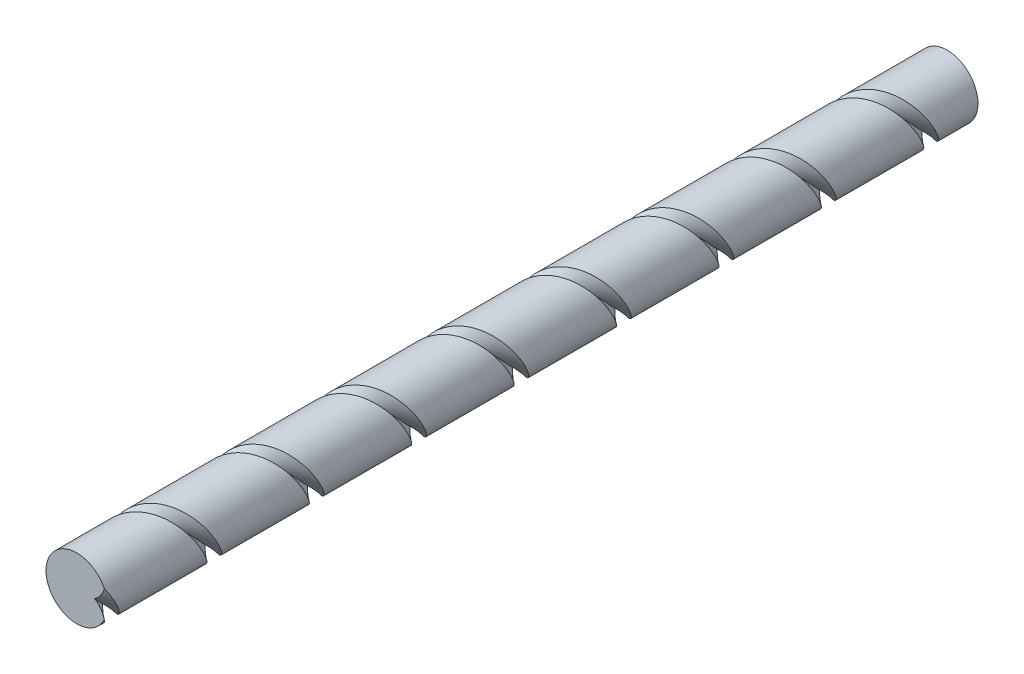
from build123d import *

# Parameters (mm, degrees)
CROQUIS1_R              = 6
SALIENTE_EXTRUIR1_DEPTH = 170
CORTAR_BARRER2_PITCH    = 20


with BuildPart() as part:
    # Croquis1 → Saliente-Extruir1 (new body)
    with BuildSketch(Plane.XY):
        Circle(CROQUIS1_R)
    extrude(amount=SALIENTE_EXTRUIR1_DEPTH)

    # Cortar-Barrer2: arcs per turn and ends read off the stored shape
    # Cortar-Barrer2: the profile of Croquis4 screwed along a right-hand helix through 61 turns, 12 arcs to a turn; built about Z, then put on its axis
    cortar_barrer2_z = Axis((0, 0, 0), (0, 0, 1))
    cortar_barrer2_corners = [(6, 0, -20), (6, 0, -18.556624327), (3.5, 0, -20), (6, 0, -21.443375673)]
    with BuildLine(mode=Mode.PRIVATE) as cortar_barrer2_profile:
        Line(cortar_barrer2_corners[0], cortar_barrer2_corners[1])
        Line(cortar_barrer2_corners[1], cortar_barrer2_corners[2])
        Line(cortar_barrer2_corners[2], cortar_barrer2_corners[3])
        Line(cortar_barrer2_corners[3], cortar_barrer2_corners[0])
    cortar_barrer2_cap = Face(cortar_barrer2_profile.wire())
    cortar_barrer2_turn_angles = [0, 15, 30, 45, 60, 75, 90, 105, 120, 135, 150, 165, 180, 195, 210, 225, 240, 255, 270, 285, 300, 315, 330, 345, 360]
    cortar_barrer2_turn_weights = [1, 0.9659258262890683, 1, 0.9659258262890683, 1, 0.9659258262890683, 1, 0.9659258262890683, 1, 0.9659258262890683, 1, 0.9659258262890683, 1, 0.9659258262890683, 1, 0.9659258262890683, 1, 0.9659258262890683, 1, 0.9659258262890683, 1, 0.9659258262890683, 1, 0.9659258262890683, 1]
    cortar_barrer2_turn_rails = [Edge.make_bspline([Vector(p[0], p[1], 0).rotate(cortar_barrer2_z, cortar_barrer2_turn_angles[k]) / cortar_barrer2_turn_weights[k] + Vector(0, 0, p[2] + CORTAR_BARRER2_PITCH * cortar_barrer2_turn_angles[k] / 360) for k in range(25)], [0, 0, 0, 1, 1, 2, 2, 3, 3, 4, 4, 5, 5, 6, 6, 7, 7, 8, 8, 9, 9, 10, 10, 11, 11, 12, 12, 12], 2, cortar_barrer2_turn_weights) for p in cortar_barrer2_corners]
    cortar_barrer2_turn_sides = [Face.make_surface_from_curves(cortar_barrer2_turn_rails[p[0]], cortar_barrer2_turn_rails[p[1]]) for p in [(0, 1), (1, 2), (2, 3), (3, 0)]]
    cortar_barrer2 = Plane(origin=(0, 0, 170), x_dir=(1, 0, 0), z_dir=(0, 0, -1)) * Solid(Shell([*[p.moved(Location((0, 0, CORTAR_BARRER2_PITCH * i))) for i in range(61) for p in cortar_barrer2_turn_sides], cortar_barrer2_cap, cortar_barrer2_cap.rotate(cortar_barrer2_z, 21960).moved(Location((0, 0, CORTAR_BARRER2_PITCH * 21960 / 360)))]))
    add(cortar_barrer2, mode=Mode.SUBTRACT)


solid = part.part
